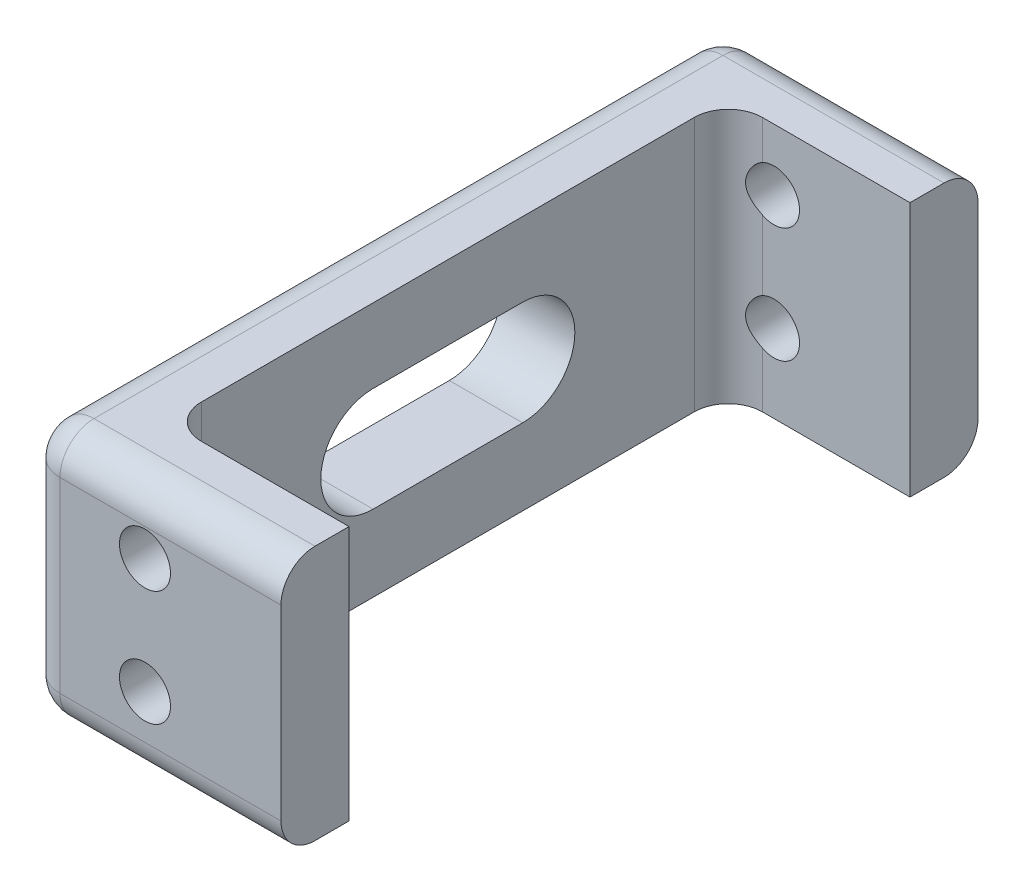
from build123d import *

# Parameters (mm, degrees)
SKETCH_1_W               = 15
SKETCH_1_H               = 15
EXTRUDE_1_DEPTH          = 41
SKETCH_2_W               = 33
SKETCH_2_H               = 15
CUT_EXTRUDE_1_DEPTH      = 10.686952674
CUT_EXTRUDE_3_DEPTH      = 47.16275555
CUT_EXTRUDE_3_DEPTH_BACK = 47.16275555
SKETCH_3_R               = 1.5
CUT_EXTRUDE_4_DEPTH      = 47.16275555
FILLET_1_R               = 2
FILLET_2_R               = 2
FILLET_3_R               = 2
FILLET_4_R               = 2
FILLET_5_R               = 2
FILLET_6_R               = 2
FILLET_7_R               = 2


with BuildPart() as part:
    # 草图1 → 凸台-拉伸1 (new body)
    with BuildSketch(Plane.XY):
        with Locations((7.5, -7.5)):
            Rectangle(SKETCH_1_W, SKETCH_1_H)
    extrude(amount=EXTRUDE_1_DEPTH)

    # 草图2 → 切除-拉伸1 (cut)
    with BuildSketch(Plane(origin=(15, 0, 0), x_dir=(0, 0, -1), z_dir=(1, 0, 0))):
        with Locations((-20.5, -7.5)):
            Rectangle(SKETCH_2_W, SKETCH_2_H)
    extrude(amount=-CUT_EXTRUDE_1_DEPTH, mode=Mode.SUBTRACT)

    # 草图3 → 切除-拉伸3 (cut, two sides: drawn at the far end of the back side and taken through both)
    with BuildSketch(Plane.XY.offset(41).offset(-CUT_EXTRUDE_3_DEPTH_BACK)):
        with Locations((7, -3.629065036)):
            Circle(SKETCH_3_R)
        with Locations((7, -10.409065036)):
            Circle(SKETCH_3_R)
    extrude(amount=CUT_EXTRUDE_3_DEPTH + CUT_EXTRUDE_3_DEPTH_BACK, mode=Mode.SUBTRACT)

    # 草图4 → 切除-拉伸4 (cut, through all)
    with BuildSketch(Plane.ZY):
        with BuildLine():
            Line((16.1, -4.363439511), (24.89752721, -4.363439511))
            ThreePointArc((24.89752721, -4.363439511), (27.970585717, -7.436498018), (24.89752721, -10.509556524))
            Line((24.89752721, -10.509556524), (16.1, -10.509556524))
            ThreePointArc((16.1, -10.509556524), (13.026941494, -7.436498018), (16.1, -4.363439511))
        make_face()
    extrude(amount=-CUT_EXTRUDE_4_DEPTH, mode=Mode.SUBTRACT)

    # 圆角1
    fillet_1_edges = [part.edges().sort_by_distance(p)[0] for p in [
        (7.5, 0, 41),
    ]]
    fillet(fillet_1_edges, radius=FILLET_1_R)

    # 圆角2
    # the kernel refuses this fillet: 2 mm, written as the material it adds along each edge
    with BuildSketch(Plane(origin=(4.313047326, 0, 37), x_dir=(1, 0, 0), z_dir=(0, -1, 0))) as fillet_2_piece_1_section:
        with BuildLine():
            CenterArc((FILLET_2_R, -FILLET_2_R), FILLET_2_R, 90, 90)
            Line((0, -FILLET_2_R), (0, 0))
            Line((0, 0), (FILLET_2_R, 0))
        make_face()
    fillet_2_piece_1 = extrude(amount=15, mode=Mode.PRIVATE)
    fillet_2_piece_1 = fillet_2_piece_1 - Plane(origin=(7, -10.409065036, 36.539920903), x_dir=(1, 0, 0), z_dir=(0, 0, 1)) * Cylinder(1.5, 38, mode=Mode.PRIVATE)
    fillet_2_piece_1 = fillet_2_piece_1 - Plane(origin=(7, -3.629065036, 36.539920903), x_dir=(1, 0, 0), z_dir=(0, 0, 1)) * Cylinder(1.5, 38, mode=Mode.PRIVATE)
    add(fillet_2_piece_1)

    # 圆角3
    # the kernel refuses this fillet: 2 mm, written as the material it adds along each edge
    with BuildSketch(Plane(origin=(4.313047326, -15, 4), x_dir=(0, 0, 1), z_dir=(0, 1, 0))) as fillet_3_piece_1_section:
        with BuildLine():
            CenterArc((FILLET_3_R, FILLET_3_R), FILLET_3_R, 180, 90)
            Line((0, FILLET_3_R), (0, 0))
            Line((0, 0), (FILLET_3_R, 0))
        make_face()
    fillet_3_piece_1 = extrude(amount=15, mode=Mode.PRIVATE)
    fillet_3_piece_1 = fillet_3_piece_1 - Plane(origin=(7, -10.409065036, 4.460079004), x_dir=(1, 0, 0), z_dir=(0, 0, 1)) * Cylinder(1.5, 38, mode=Mode.PRIVATE)
    fillet_3_piece_1 = fillet_3_piece_1 - Plane(origin=(7, -3.629065036, 4.460079004), x_dir=(1, 0, 0), z_dir=(0, 0, 1)) * Cylinder(1.5, 38, mode=Mode.PRIVATE)
    add(fillet_3_piece_1)

    # 圆角4
    fillet_4_edges = [part.edges().sort_by_distance(p)[0] for p in [
        (7.5, -15, 41),
    ]]
    fillet(fillet_4_edges, radius=FILLET_4_R)

    # 圆角5
    fillet_5_edges = [part.edges().sort_by_distance(p)[0] for p in [
        (7.5, 0, 0),
    ]]
    fillet(fillet_5_edges, radius=FILLET_5_R)

    # 圆角6
    fillet_6_edges = [part.edges().sort_by_distance(p)[0] for p in [
        (7.5, -15, 0),
    ]]
    fillet(fillet_6_edges, radius=FILLET_6_R)

    # 圆角7
    fillet_7_edges = [part.edges().sort_by_distance(p)[0] for p in [
        (0, -15, 20.5),
        (0, -14.414213562, 40.414213562),
        (0, -7.5, 0),
        (0, -0.585786438, 0.585786438),
        (0, -14.414213562, 0.585786438),
        (0, 0, 20.5),
        (0, -7.5, 41),
        (0, -0.585786438, 40.414213562),
    ]]
    fillet(fillet_7_edges, radius=FILLET_7_R)


solid = part.part
